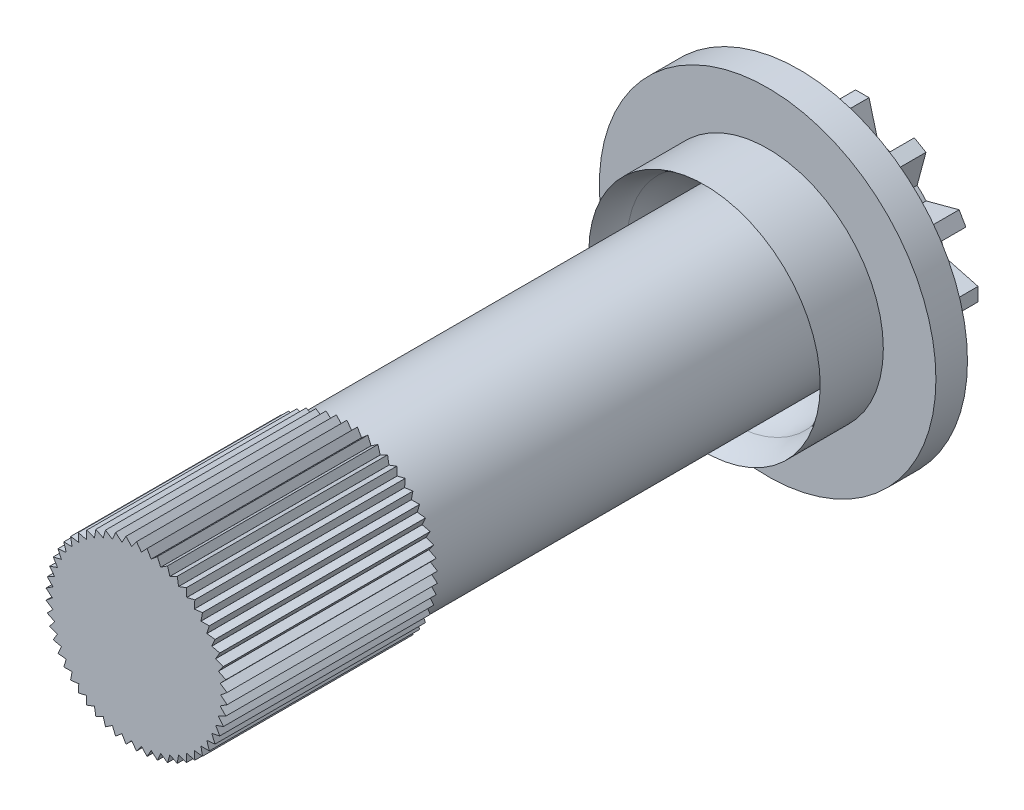
from build123d import *

# Parameters (mm, degrees)
SKETCH1_R           = 4
BOSS_EXTRUDE1_DEPTH = 3
BOSS_EXTRUDE2_DEPTH = 3
CIRPATTERN1_COUNT   = 12
SKETCH3_R           = 8
BOSS_EXTRUDE3_DEPTH = 1.5
SKETCH4_R           = 4
BOSS_EXTRUDE4_DEPTH = 30
BOSS_EXTRUDE5_DEPTH = 10
CIRPATTERN2_COUNT   = 54
SKETCH6_R           = 5.5
SKETCH6_R_2         = 5
BOSS_EXTRUDE6_DEPTH = 3
FILLET3_R           = 3
FILLET4_R           = 3


with BuildPart() as part:
    # Sketch1 → Boss-Extrude1 (new body)
    with BuildSketch(Plane.XY):
        Circle(SKETCH1_R)
    extrude(amount=BOSS_EXTRUDE1_DEPTH)

    # Sketch2 → Boss-Extrude2 (add)
    with BuildSketch(Plane(origin=(0, 0, 0), x_dir=(-1, 0, 0), z_dir=(0, 0, -1))):
        Polygon((0, 5.5), (-0.32, 5.5), (-0.764795659, 3.84), (0.764795659, 3.84), (0.32, 5.5), align=None)
    boss_extrude2 = extrude(amount=-BOSS_EXTRUDE2_DEPTH)

    # CirPattern1: Boss-Extrude2 ×12 about axis
    cirpattern1_axis = Axis((0, 0, 0), (0, 0, 1))
    for i in range(1, CIRPATTERN1_COUNT):
        add(boss_extrude2.rotate(cirpattern1_axis, i * 360 / CIRPATTERN1_COUNT))

    # Sketch3 → Boss-Extrude3 (add)
    with BuildSketch(Plane.XY.offset(3)):
        Circle(SKETCH3_R)
    extrude(amount=BOSS_EXTRUDE3_DEPTH)

    # Sketch4 → Boss-Extrude4 (add)
    with BuildSketch(Plane.XY.offset(4.5)):
        Circle(SKETCH4_R)
    extrude(amount=BOSS_EXTRUDE4_DEPTH)

    # Sketch5 → Boss-Extrude5 (add)
    with BuildSketch(Plane.XY.offset(34.5)):
        Polygon((-0.375122906, 3.797178952), (0, 4.310713244), (0.375122906, 3.797178952), align=None)
    boss_extrude5 = extrude(amount=-BOSS_EXTRUDE5_DEPTH)

    # CirPattern2: Boss-Extrude5 ×54 about axis
    cirpattern2_axis = Axis((0, 0, 0), (0, 0, 1))
    for i in range(1, CIRPATTERN2_COUNT):
        add(boss_extrude5.rotate(cirpattern2_axis, i * 360 / CIRPATTERN2_COUNT))

    # Sketch6 → Boss-Extrude6 (add)
    with BuildSketch(Plane.XY.offset(4.5)):
        Circle(SKETCH6_R)
        Circle(SKETCH6_R_2, mode=Mode.SUBTRACT)
    extrude(amount=BOSS_EXTRUDE6_DEPTH)

    # Fillet3
    # the kernel refuses this fillet: 3 mm, written as the material it adds along each edge
    with BuildSketch(Plane(origin=(0, 0, 4.5), x_dir=(1, 0, 0), z_dir=(0, -1, 0))) as fillet3_piece_1:
        with BuildLine():
            CenterArc((2, 2.236067977), FILLET3_R, 311.810314896, 48.189685104)
            Line((4, 0), (4.04, -0.04472136))
            ThreePointArc((4.04, -0.04472136), (4.5, -0.06), (5, -0.06))
            Line((5, -0.06), (5.06, 0))
            Line((5.06, 0), (5.06, 2.236067977))
            Line((5.06, 2.236067977), (5, 2.236067977))
        make_face()
    revolve(axis=Axis((0, 0, 4.5), (0, 0, 1)))

    # Fillet4
    # the kernel refuses this fillet: 3 mm, written as the material it takes off along each edge
    with BuildSketch(Plane(origin=(0, 0, 7.5), x_dir=(1, 0, 0), z_dir=(0, -1, 0))) as fillet4_piece_1:
        with BuildLine():
            CenterArc((7.912876379, -1.782702325), FILLET4_R, 143.541947331, 26.682149592)
            Line((5.5, 0), (5.258712362, 0.178270233))
            ThreePointArc((5.258712362, 0.178270233), (5.25, 0.3), (5, 0.3))
            Line((5, 0.3), (4.7, 0))
            ThreePointArc((4.7, 0), (4.7, -0.763932023), (4.66079437, -1.222378659))
            Line((4.66079437, -1.222378659), (4.956438189, -1.273317174))
        make_face()
    revolve(axis=Axis((0, 0, 7.5), (0, 0, 1)), mode=Mode.SUBTRACT)


solid = part.part
